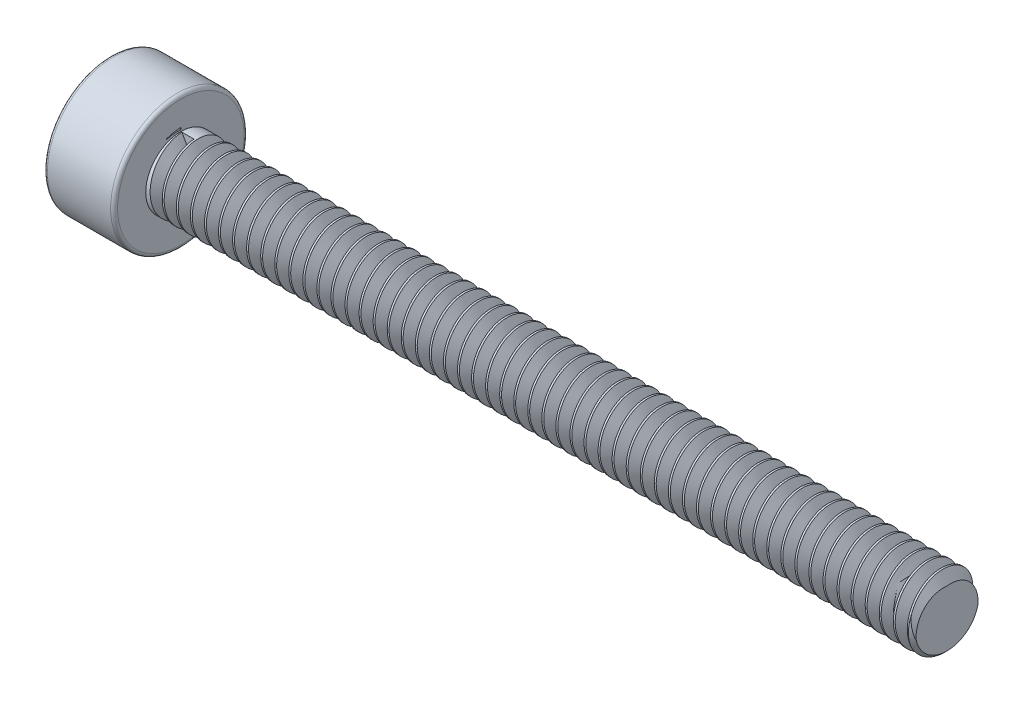
from build123d import *

# Parameters (mm, degrees)
EXTRUDE1_DEPTH   = 1
CUT_SWEEP2_PITCH = 0.4


with BuildPart() as part:
    # Sketch1 → Revolve1 (revolve)
    with BuildSketch(Plane.XY, mode=Mode.PRIVATE) as revolve1_sk:
        with BuildLine():
            Line((0, 0), (0, 1.8))
            ThreePointArc((0, 1.8), (-0.029289322, 1.870710678), (-0.1, 1.9))
            Line((-0.1, 1.9), (-1.9, 1.9))
            ThreePointArc((-1.9, 1.9), (-1.970710678, 1.870710678), (-2, 1.8))
            Line((-2, 1.8), (-2, 0))
            Line((-2, 0), (0, 0))
        make_face()
    revolve(revolve1_sk.sketch.rotate(Axis((0, 0, 0), (-1, 0, 0)), 90), axis=Axis((0, 0, 0), (-1, 0, 0)))

    # Sketch2 → Extrude1 (cut)
    with BuildSketch(Plane.ZY.offset(2)):
        Polygon((0.866025404, 0), (0.433012702, 0.75), (-0.433012702, 0.75), (-0.866025404, 0), (-0.433012702, -0.75), (0.433012702, -0.75), align=None)
    extrude(amount=-EXTRUDE1_DEPTH, mode=Mode.SUBTRACT)

    # Sketch3 → Revolve2 (revolve)
    with BuildSketch(Plane.XY, mode=Mode.PRIVATE) as revolve2_sk:
        Polygon((21.8, 0.9), (21.7, 1), (0, 1), (0, 0), (21.8, 0), align=None)
    revolve(revolve2_sk.sketch.rotate(Axis((0, 0, 0), (1, 0, 0)), 90), axis=Axis((0, 0, 0), (1, 0, 0)))

    # Cut-Sweep2: the profile of Sketch4 screwed along a right-hand helix of 55 turns, 6 arcs to a turn; built about Z, then put on its axis
    cut_sweep2_z = Axis((0, 0, 0), (0, 0, 1))
    cut_sweep2_corners = [(1.1, 0, -0.169059892), (0.7, 0, -0.4), (1.1, 0, -0.630940108)]
    with BuildLine(mode=Mode.PRIVATE) as cut_sweep2_profile:
        Line(cut_sweep2_corners[0], cut_sweep2_corners[1])
        Line(cut_sweep2_corners[1], cut_sweep2_corners[2])
        Line(cut_sweep2_corners[2], cut_sweep2_corners[0])
    cut_sweep2_cap = Face(cut_sweep2_profile.wire())
    cut_sweep2_turn_angles = [0, 30, 60, 90, 120, 150, 180, 210, 240, 270, 300, 330, 360]
    cut_sweep2_turn_weights = [1, 0.8660254037844387, 1, 0.8660254037844387, 1, 0.8660254037844387, 1, 0.8660254037844387, 1, 0.8660254037844387, 1, 0.8660254037844387, 1]
    cut_sweep2_turn_rails = [Edge.make_bspline([Vector(p[0], p[1], 0).rotate(cut_sweep2_z, cut_sweep2_turn_angles[k]) / cut_sweep2_turn_weights[k] + Vector(0, 0, p[2] + CUT_SWEEP2_PITCH * cut_sweep2_turn_angles[k] / 360) for k in range(13)], [0, 0, 0, 1, 1, 2, 2, 3, 3, 4, 4, 5, 5, 6, 6, 6], 2, cut_sweep2_turn_weights) for p in cut_sweep2_corners]
    cut_sweep2_turn_sides = [Face.make_surface_from_curves(cut_sweep2_turn_rails[p[0]], cut_sweep2_turn_rails[p[1]]) for p in [(0, 1), (1, 2), (2, 0)]]
    cut_sweep2_turn = Solid(Shell([*cut_sweep2_turn_sides, cut_sweep2_cap, cut_sweep2_cap.rotate(cut_sweep2_z, 360).moved(Location((0, 0, CUT_SWEEP2_PITCH * 360 / 360)))]))
    cut_sweep2_each = [*[cut_sweep2_turn.moved(Location((0, 0, CUT_SWEEP2_PITCH * i))) for i in range(55)]]
    add(Plane(origin=(21.8, 0, 0), x_dir=(0, 1, 0), z_dir=(-1, 0, 0)) * Compound([cut_sweep2_each[i] for i in range(0, 55, 2)]), mode=Mode.SUBTRACT)
    add(Plane(origin=(21.8, 0, 0), x_dir=(0, 1, 0), z_dir=(-1, 0, 0)) * Compound([cut_sweep2_each[i] for i in range(1, 55, 2)]), mode=Mode.SUBTRACT)


solid = part.part
